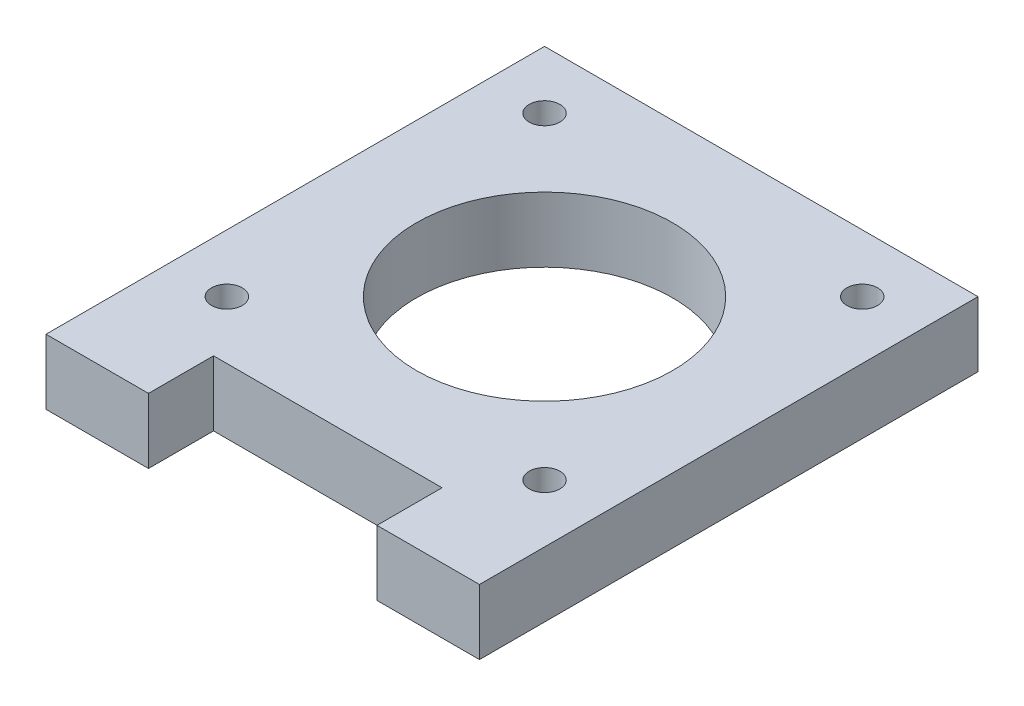
from build123d import *

# Parameters (mm, degrees)
SKETCH1_R           = 12.5
SKETCH1_R_2         = 1.5
BOSS_EXTRUDE1_DEPTH = 3.175


with BuildPart() as part:
    # Sketch1 → Boss-Extrude1 (new, symmetric)
    with BuildSketch(Plane(origin=(0, 0, 0), x_dir=(1, 0, 0), z_dir=(0, 1, 0))):
        Polygon((-21.15, -21.15), (-21.15, -27.5), (-11.15, -27.5), (-11.15, -21.15), (11.15, -21.15), (11.15, -27.5), (21.15, -27.5), (21.15, -21.15), (21.15, 21.15), (-21.15, 21.15), align=None)
        Circle(SKETCH1_R, mode=Mode.SUBTRACT)
        with Locations((-15.5, 15.5)):
            Circle(SKETCH1_R_2, mode=Mode.SUBTRACT)
        with Locations((15.5, 15.5)):
            Circle(SKETCH1_R_2, mode=Mode.SUBTRACT)
        with Locations((15.5, -15.5)):
            Circle(SKETCH1_R_2, mode=Mode.SUBTRACT)
        with Locations((-15.5, -15.5)):
            Circle(SKETCH1_R_2, mode=Mode.SUBTRACT)
    extrude(amount=BOSS_EXTRUDE1_DEPTH, both=True)


solid = part.part
